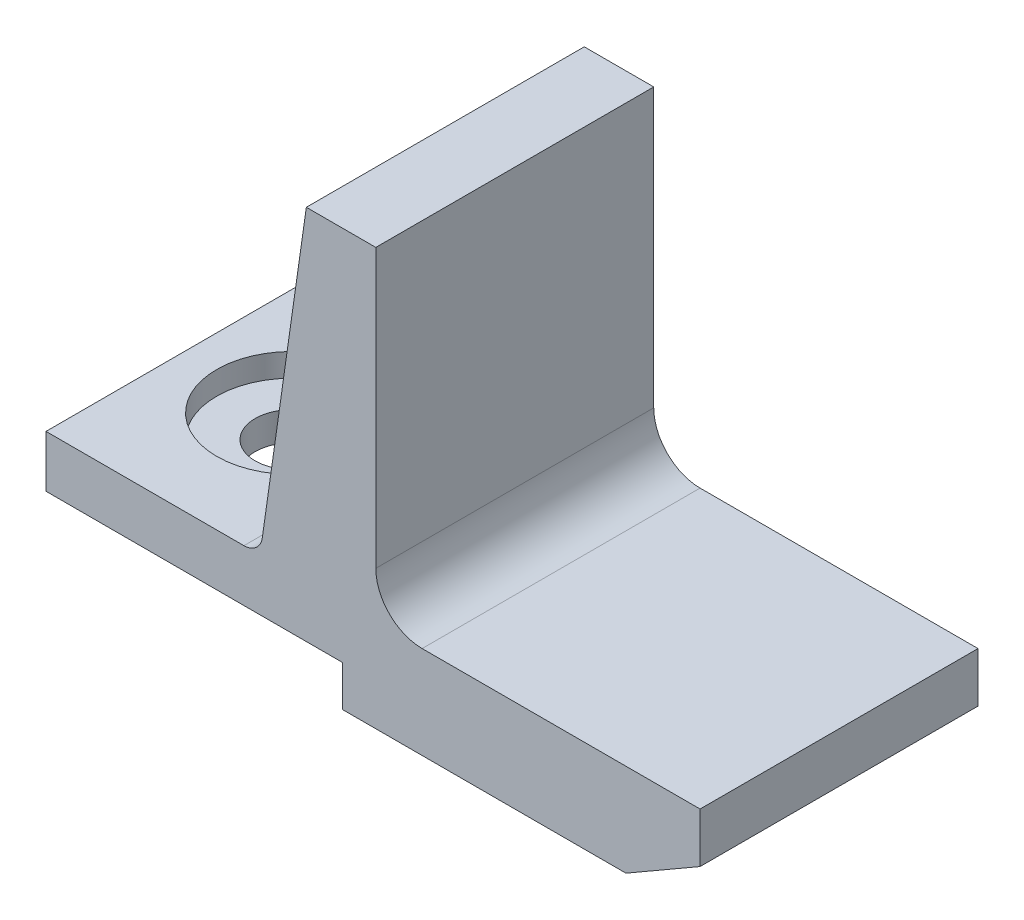
from build123d import *

# Parameters (mm, degrees)
BOSS_EXTRUDE1_DEPTH                                  = 38.1
CBORE_FOR_3_8_BINDING_HEAD_MACHINE_SCREW_D           = 10.0838
CBORE_FOR_3_8_BINDING_HEAD_MACHINE_SCREW_CBORE_D     = 20.6375
CBORE_FOR_3_8_BINDING_HEAD_MACHINE_SCREW_CBORE_DEPTH = 3.175
CHAMFER1_SIZE                                        = 10.16
CHAMFER1_SIZE2                                       = 5.865878735
FILLET1_R                                            = 2.54
FILLET2_R                                            = 6.35


with BuildPart() as part:
    # Sketch1 → Boss-Extrude1 (new body)
    with BuildSketch(Plane.XY):
        Polygon((0, 0), (44.45, 0), (44.45, -12.7), (-4.572, -12.7), (-4.572, -7.112), (-45.212, -7.112), (-45.212, 0), (-15.875, 0), (-9.525, 44.45), (0, 44.45), align=None)
    extrude(amount=BOSS_EXTRUDE1_DEPTH)

    # CBORE for 3/8 Binding Head Machine Screw1 (through all)
    with Locations(Plane(origin=(0, 0, 0), x_dir=(1, 0, 0), z_dir=(0, 1, 0))):
        with Locations((-30.5435, -19.05)):
            CounterBoreHole(CBORE_FOR_3_8_BINDING_HEAD_MACHINE_SCREW_D / 2, CBORE_FOR_3_8_BINDING_HEAD_MACHINE_SCREW_CBORE_D / 2, CBORE_FOR_3_8_BINDING_HEAD_MACHINE_SCREW_CBORE_DEPTH)

    # Chamfer1
    chamfer1_edges = [part.edges().sort_by_distance(p)[0] for p in [
        (44.45, -12.7, 19.05),
    ]]
    chamfer1_side = [part.faces().sort_by_distance(p)[0] for p in [
        (19.939, -12.7, 19.05),
    ]]
    chamfer(chamfer1_edges, length=CHAMFER1_SIZE, length2=CHAMFER1_SIZE2, reference=chamfer1_side[0])

    # Fillet1
    fillet1_edges = [part.edges().sort_by_distance(p)[0] for p in [
        (-15.875, 0, 19.05),
    ]]
    fillet(fillet1_edges, radius=FILLET1_R)

    # Fillet2
    fillet2_edges = [part.edges().sort_by_distance(p)[0] for p in [
        (0, 0, 19.05),
    ]]
    fillet(fillet2_edges, radius=FILLET2_R)


solid = part.part
